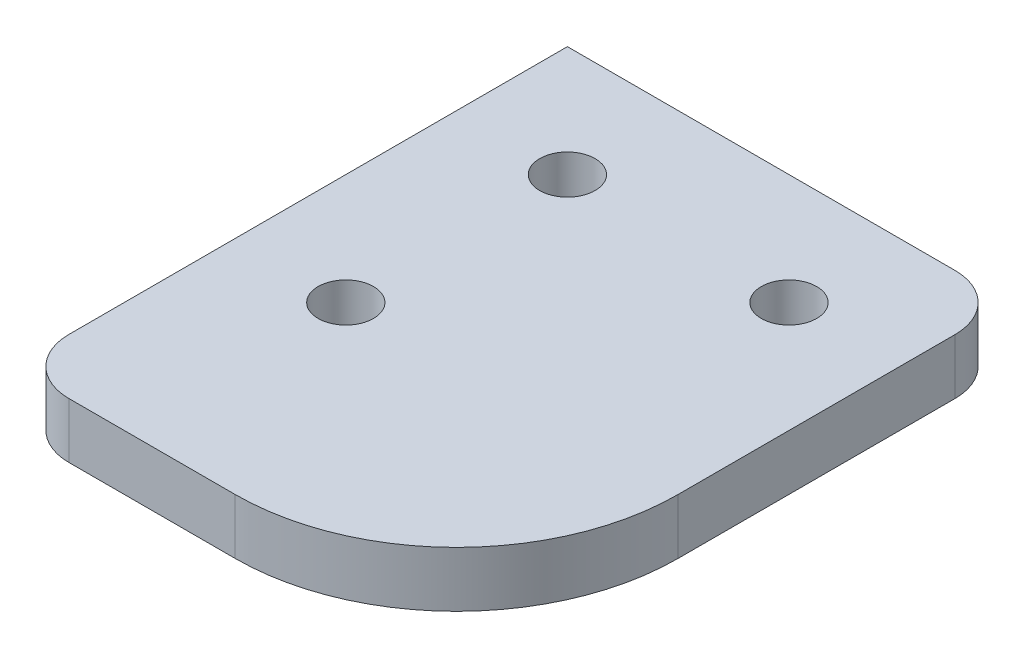
from build123d import *

# Parameters (mm, degrees)
SKETCH1_R           = 2.5
BOSS_EXTRUDE1_DEPTH = 5
FILLET1_R           = 5


with BuildPart() as part:
    # Sketch1 → Boss-Extrude1 (new body)
    with BuildSketch(Plane(origin=(0, 0, 0), x_dir=(1, 0, 0), z_dir=(0, 1, 0))):
        with BuildLine():
            Line((-20, 20), (20, 20))
            Line((20, 20), (20, -10))
            ThreePointArc((20, -10), (14.142135624, -24.142135624), (0, -30))
            Line((0, -30), (-20, -30))
            Line((-20, -30), (-20, 20))
        make_face()
        with Locations((-10, 10)):
            Circle(SKETCH1_R, mode=Mode.SUBTRACT)
        with Locations((10, 10)):
            Circle(SKETCH1_R, mode=Mode.SUBTRACT)
        with Locations((-10, -10)):
            Circle(SKETCH1_R, mode=Mode.SUBTRACT)
    extrude(amount=BOSS_EXTRUDE1_DEPTH)

    # Fillet1
    fillet1_edges = [part.edges().sort_by_distance(p)[0] for p in [
        (20, 2.5, -20),
        (-20, 2.5, 30),
    ]]
    fillet(fillet1_edges, radius=FILLET1_R)


solid = part.part
